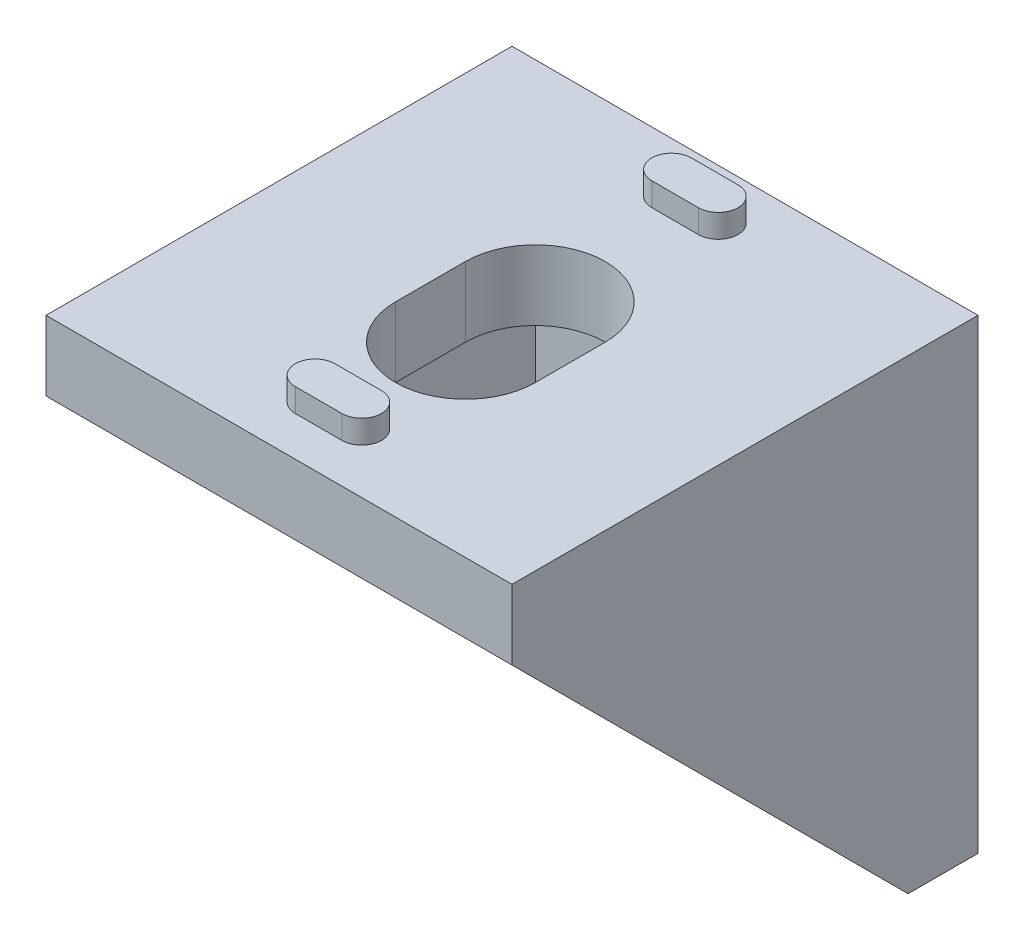
from build123d import *

# Parameters (mm, degrees)
BOSS_EXTRUDE1_DEPTH = 10
SKETCH2_W           = 17
SKETCH2_H           = 17
CUT_EXTRUDE1_DEPTH  = 6
CUT_EXTRUDE2_REACH  = 30.089
BOSS_EXTRUDE2_DEPTH = 1


with BuildPart() as part:
    # Sketch1 → Boss-Extrude1 (new, symmetric)
    with BuildSketch(Plane(origin=(0, 0, 0), x_dir=(0, 0, -1), z_dir=(1, 0, 0))):
        Polygon((0, 0), (-20, 0), (-20, -3), (-11.5, -11.5), (-3, -20), (0, -20), align=None)
    extrude(amount=BOSS_EXTRUDE1_DEPTH, both=True)

    # Sketch2 → Cut-Extrude1 (cut, symmetric)
    with BuildSketch(Plane(origin=(0, 0, 0), x_dir=(0, 0, -1), z_dir=(1, 0, 0))):
        with Locations((-11.5, -11.5)):
            Rectangle(SKETCH2_W, SKETCH2_H)
    extrude(amount=CUT_EXTRUDE1_DEPTH, both=True, mode=Mode.SUBTRACT)

    # Sketch3 → Cut-Extrude2 (cut, up to next)
    with BuildSketch(Plane.XY.offset(3), mode=Mode.PRIVATE) as cut_extrude2_sk1:
        with BuildLine():
            Line((-3, -9), (-3, -12))
            ThreePointArc((-3, -12), (0, -15), (3, -12))
            Line((3, -12), (3, -9))
            ThreePointArc((3, -9), (0, -6), (-3, -9))
        make_face()
    cut_extrude2_tool1 = extrude(cut_extrude2_sk1.sketch, amount=-CUT_EXTRUDE2_REACH, mode=Mode.PRIVATE) & part.part
    cut_extrude2 = cut_extrude2_tool1.solids().sort_by_distance((0, -10.5, 3))[0]
    add(cut_extrude2, mode=Mode.SUBTRACT)

    # Sketch4 → Boss-Extrude2 (add)
    with BuildSketch(Plane(origin=(0, 0, 0), x_dir=(-1, 0, 0), z_dir=(0, 0, -1))):
        with BuildLine():
            Line((-1, -3), (1, -3))
            ThreePointArc((1, -3), (1.85, -2.15), (1, -1.3))
            Line((1, -1.3), (-1, -1.3))
            ThreePointArc((-1, -1.3), (-1.85, -2.15), (-1, -3))
        make_face()
        with BuildLine():
            Line((-1, -18.3), (1, -18.3))
            ThreePointArc((1, -18.3), (1.85, -17.45), (1, -16.6))
            Line((1, -16.6), (-1, -16.6))
            ThreePointArc((-1, -16.6), (-1.85, -17.45), (-1, -18.3))
        make_face()
    boss_extrude2 = extrude(amount=BOSS_EXTRUDE2_DEPTH)

    # Mirror1: Cut-Extrude2, Boss-Extrude2 across plane
    add(cut_extrude2.mirror(Plane(origin=(0, 0, 0), x_dir=(0, -0.7071067811865481, 0.707106781186547), z_dir=(0, 0.7071067811865471, 0.707106781186548))), mode=Mode.SUBTRACT)
    add(boss_extrude2.mirror(Plane(origin=(0, 0, 0), x_dir=(0, -0.7071067811865481, 0.707106781186547), z_dir=(0, 0.7071067811865471, 0.707106781186548))))


solid = part.part
